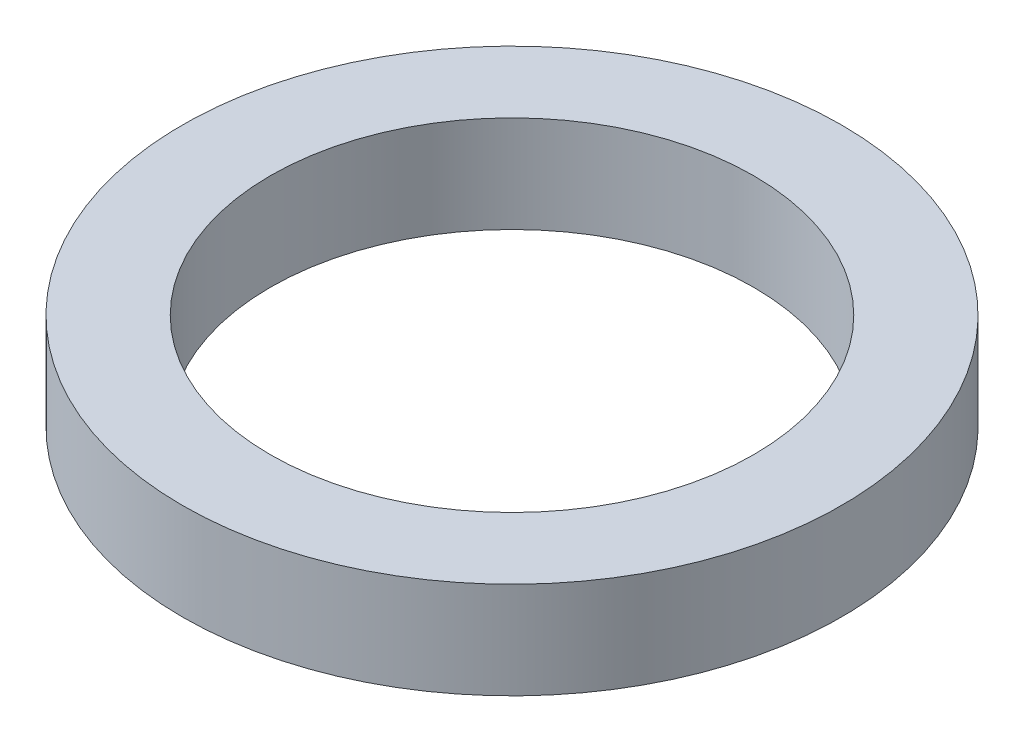
from build123d import *

# Parameters (mm, degrees)
SKETCH1_R           = 37.5
BOSS_EXTRUDE1_DEPTH = 11
SKETCH2_R           = 27.5
CUT_EXTRUDE1_DEPTH  = 55.161794653


with BuildPart() as part:
    # Sketch1 → Boss-Extrude1 (new body)
    with BuildSketch(Plane(origin=(0, 0, 0), x_dir=(1, 0, 0), z_dir=(0, 1, 0))):
        Circle(SKETCH1_R)
    extrude(amount=BOSS_EXTRUDE1_DEPTH)

    # Sketch2 → Cut-Extrude1 (cut, through all)
    with BuildSketch(Plane(origin=(0, 0, 0), x_dir=(1, 0, 0), z_dir=(0, 1, 0))):
        Circle(SKETCH2_R)
    extrude(amount=CUT_EXTRUDE1_DEPTH, mode=Mode.SUBTRACT)


solid = part.part
